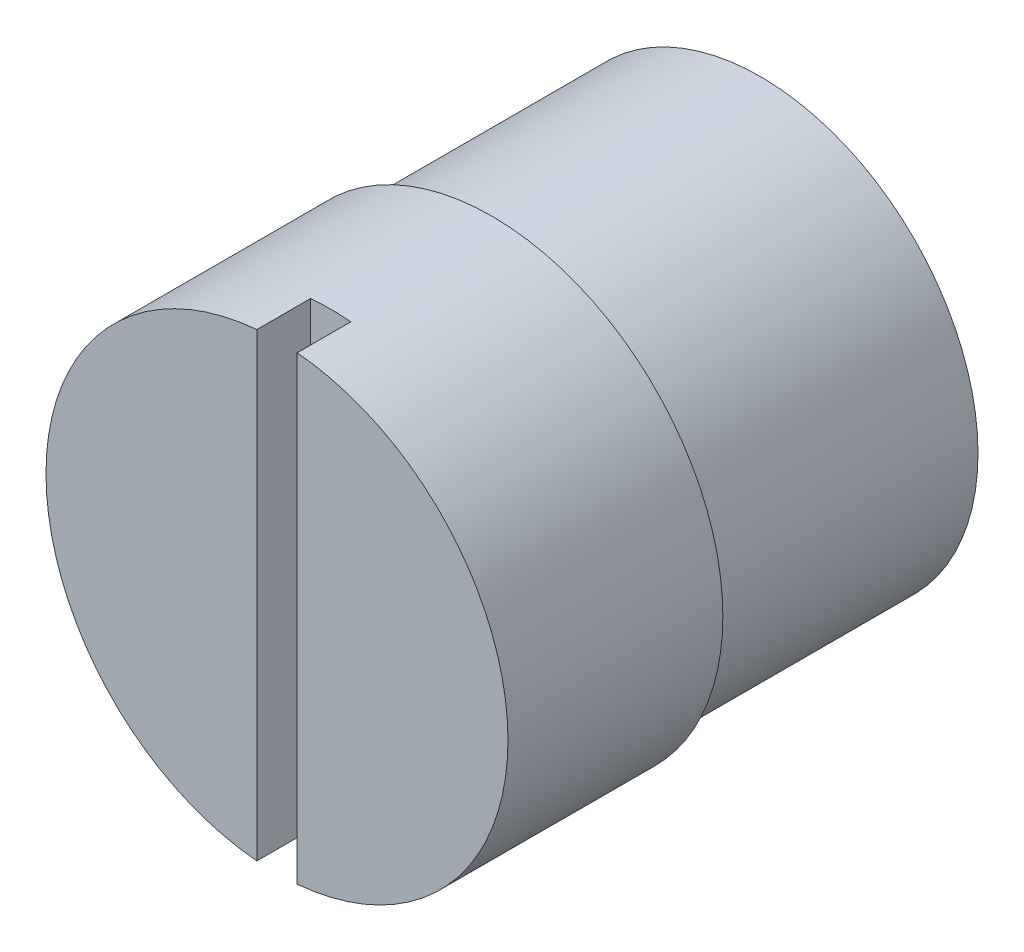
from build123d import *

# Parameters (mm, degrees)
SKETCH1_R                 = 4.05
BOSS_EXTRUDE1_DEPTH       = 5
SKETCH2_R                 = 4.3
BOSS_EXTRUDE2_DEPTH       = 4
M5X0_8_TAPPED_HOLE1_D     = 4.7
M5X0_8_TAPPED_HOLE1_DEPTH = 5
M5X0_8_TAPPED_HOLE1_TIP   = 0.629680602
CHAMFER1_SIZE             = 0.5
THREAD1_PITCH             = 0.8
SKETCH3_W                 = 0.75
SKETCH3_H                 = 8.6
CUT_EXTRUDE1_DEPTH        = 1


with BuildPart() as part:
    # Sketch1 → Boss-Extrude1 (new body)
    with BuildSketch(Plane.XY):
        Circle(SKETCH1_R)
    extrude(amount=-BOSS_EXTRUDE1_DEPTH)

    # Sketch2 → Boss-Extrude2 (add)
    with BuildSketch(Plane.XY):
        Circle(SKETCH2_R)
    extrude(amount=BOSS_EXTRUDE2_DEPTH)

    # M5x0.8 Tapped Hole1
    with Locations(Plane(origin=(0, 0, -5), x_dir=(-1, 0, 0), z_dir=(0, 0, -1))):
        with Locations((0, 0)):
            Hole(M5X0_8_TAPPED_HOLE1_D / 2, depth=M5X0_8_TAPPED_HOLE1_DEPTH)
            with Locations((0, 0, -(M5X0_8_TAPPED_HOLE1_DEPTH + M5X0_8_TAPPED_HOLE1_TIP / 2))):  # 150° drill point
                Cone(0, M5X0_8_TAPPED_HOLE1_D / 2, M5X0_8_TAPPED_HOLE1_TIP, mode=Mode.SUBTRACT)

    # Chamfer1
    chamfer1_edges = [part.edges().sort_by_distance(p)[0] for p in [
        (-2.35, 0, -5),
    ]]
    chamfer(chamfer1_edges, length=CHAMFER1_SIZE)

    # Thread1: the profile of Thread Profile1 profile screwed along a right-hand helix of 6.875 turns, 8 arcs to a turn; built about Z, then put on its axis
    thread1_z = Axis((0, 0, 0), (0, 0, 1))
    thread1_corners = [(2.3497, 0, -0.000173205), (2.7830127, 0, 0.249999999), (2.7830127, 0, 0.349999999), (2.3497, 0, 0.600173203)]
    with BuildLine(mode=Mode.PRIVATE) as thread1_profile:
        Line(thread1_corners[0], thread1_corners[1])
        Line(thread1_corners[1], thread1_corners[2])
        Line(thread1_corners[2], thread1_corners[3])
        Line(thread1_corners[3], thread1_corners[0])
    thread1_cap = Face(thread1_profile.wire())
    thread1_turn_angles = [0, 22.5, 45, 67.5, 90, 112.5, 135, 157.5, 180, 202.5, 225, 247.5, 270, 292.5, 315, 337.5, 360]
    thread1_turn_weights = [1, 0.9238795325112867, 1, 0.9238795325112867, 1, 0.9238795325112867, 1, 0.9238795325112867, 1, 0.9238795325112867, 1, 0.9238795325112867, 1, 0.9238795325112867, 1, 0.9238795325112867, 1]
    thread1_turn_rails = [Edge.make_bspline([Vector(p[0], p[1], 0).rotate(thread1_z, thread1_turn_angles[k]) / thread1_turn_weights[k] + Vector(0, 0, p[2] + THREAD1_PITCH * thread1_turn_angles[k] / 360) for k in range(17)], [0, 0, 0, 1, 1, 2, 2, 3, 3, 4, 4, 5, 5, 6, 6, 7, 7, 8, 8, 8], 2, thread1_turn_weights) for p in thread1_corners]
    thread1_turn_sides = [Face.make_surface_from_curves(thread1_turn_rails[p[0]], thread1_turn_rails[p[1]]) for p in [(0, 1), (1, 2), (2, 3), (3, 0)]]
    thread1_last_angles = [2160, 2182.5, 2205, 2227.5, 2250, 2272.5, 2295, 2317.5, 2340, 2362.5, 2385, 2407.5, 2430, 2452.5, 2475]
    thread1_last_weights = [1, 0.9238795325112867, 1, 0.9238795325112867, 1, 0.9238795325112867, 1, 0.9238795325112867, 1, 0.9238795325112867, 1, 0.9238795325112867, 1, 0.9238795325112867, 1]
    thread1_last_rails = [Edge.make_bspline([Vector(p[0], p[1], 0).rotate(thread1_z, thread1_last_angles[k]) / thread1_last_weights[k] + Vector(0, 0, p[2] + THREAD1_PITCH * thread1_last_angles[k] / 360) for k in range(15)], [0, 0, 0, 1, 1, 2, 2, 3, 3, 4, 4, 5, 5, 6, 6, 7, 7, 7], 2, thread1_last_weights) for p in thread1_corners]
    thread1_last_sides = [Face.make_surface_from_curves(thread1_last_rails[p[0]], thread1_last_rails[p[1]]) for p in [(0, 1), (1, 2), (2, 3), (3, 0)]]
    thread1 = Plane(origin=(0, 0, -6), x_dir=(1, 0, 0), z_dir=(0, 0, 1)) * Solid(Shell([*[p.moved(Location((0, 0, THREAD1_PITCH * i))) for i in range(6) for p in thread1_turn_sides], *thread1_last_sides, thread1_cap, thread1_cap.rotate(thread1_z, 2475).moved(Location((0, 0, THREAD1_PITCH * 2475 / 360)))]))
    add(thread1, mode=Mode.SUBTRACT)

    # Sketch3 → Cut-Extrude1 (cut)
    with BuildSketch(Plane.XY.offset(4)):
        Rectangle(SKETCH3_W, SKETCH3_H)
    extrude(amount=-CUT_EXTRUDE1_DEPTH, mode=Mode.SUBTRACT)


solid = part.part
